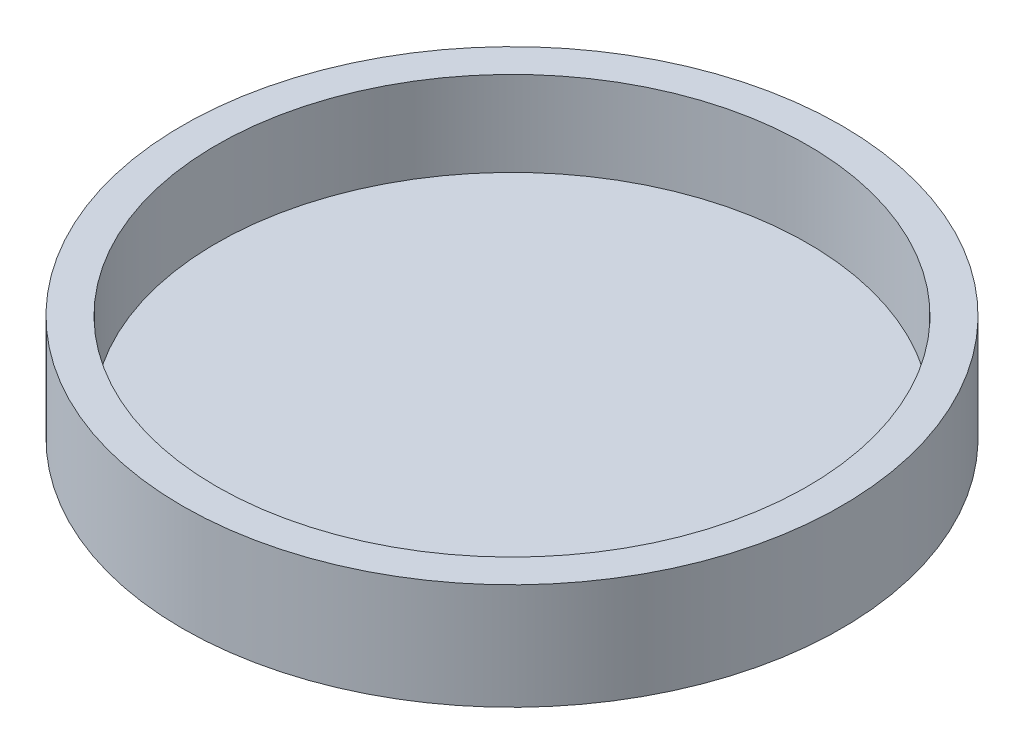
from build123d import *

# Parameters (mm, degrees)
SKETCH1_R           = 31.06
BOSS_EXTRUDE1_DEPTH = 10
SKETCH2_R           = 27.86
CUT_EXTRUDE1_DEPTH  = 8


with BuildPart() as part:
    # Sketch1 → Boss-Extrude1 (new body)
    with BuildSketch(Plane(origin=(0, 0, 0), x_dir=(1, 0, 0), z_dir=(0, 1, 0))):
        Circle(SKETCH1_R)
    extrude(amount=BOSS_EXTRUDE1_DEPTH)

    # Sketch2 → Cut-Extrude1 (cut)
    with BuildSketch(Plane(origin=(0, 10, 0), x_dir=(1, 0, 0), z_dir=(0, 1, 0))):
        Circle(SKETCH2_R)
    extrude(amount=-CUT_EXTRUDE1_DEPTH, mode=Mode.SUBTRACT)


solid = part.part
